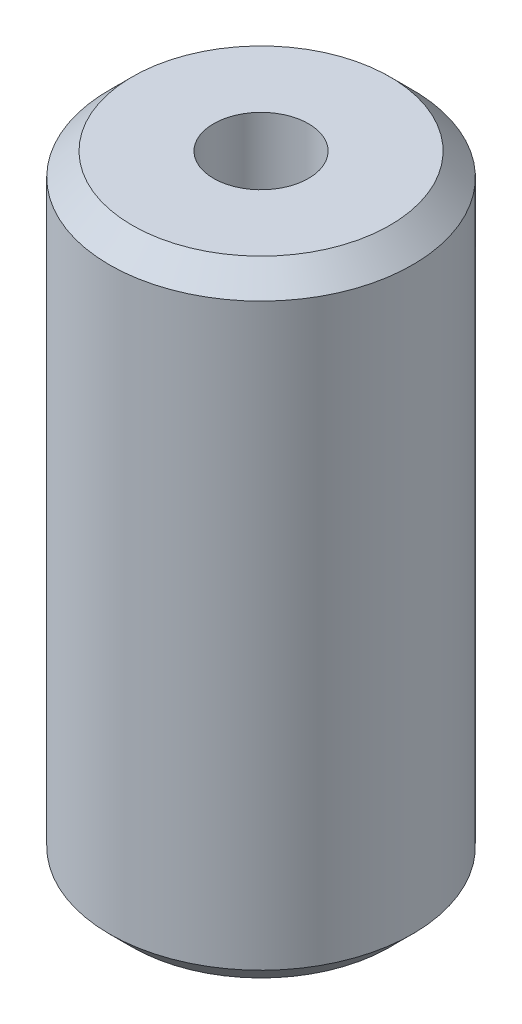
from build123d import *

# Parameters (mm, degrees)
SKETCH1_R           = 10
BOSS_EXTRUDE1_DEPTH = 41.245399229
SKETCH2_R           = 3.130830713
CUT_EXTRUDE1_DEPTH  = 44.602556778
CHAMFER1_SIZE       = 1.50470621


with BuildPart() as part:
    # Sketch1 → Boss-Extrude1 (new body)
    with BuildSketch(Plane(origin=(0, 0, 0), x_dir=(1, 0, 0), z_dir=(0, 1, 0))):
        Circle(SKETCH1_R)
    extrude(amount=BOSS_EXTRUDE1_DEPTH)

    # Sketch2 → Cut-Extrude1 (cut, through all)
    with BuildSketch(Plane(origin=(0, 0, 0), x_dir=(1, 0, 0), z_dir=(0, 1, 0))):
        Circle(SKETCH2_R)
    extrude(amount=CUT_EXTRUDE1_DEPTH, mode=Mode.SUBTRACT)

    # Chamfer1
    chamfer1_edges = [part.edges().sort_by_distance(p)[0] for p in [
        (-10, 41.245399229, 0),
        (-10, 0, 0),
    ]]
    chamfer(chamfer1_edges, length=CHAMFER1_SIZE)


solid = part.part
